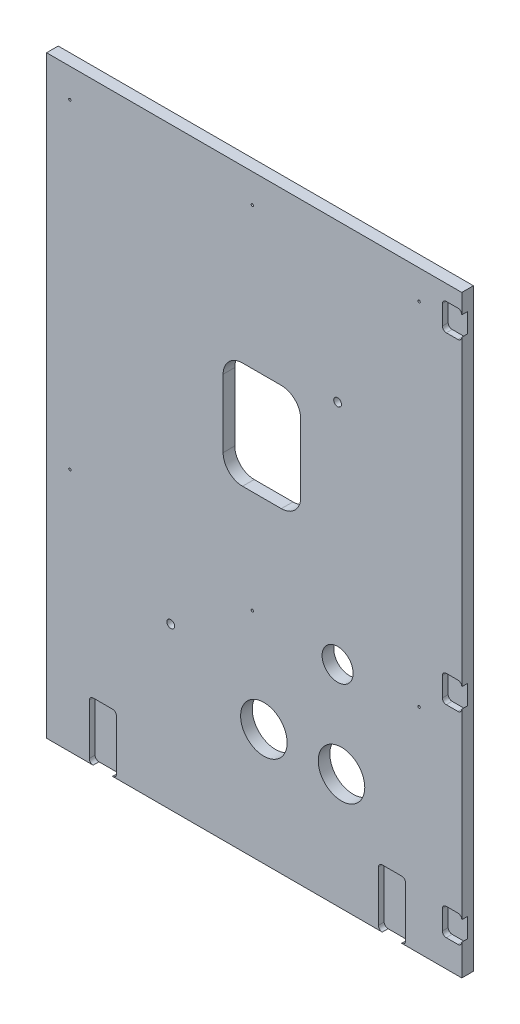
from build123d import *

# Parameters (mm, degrees)
SKETCH_1_W          = 1070
SKETCH_1_H          = 1530
EXTRUDE_1_DEPTH     = 15
SKETCH_2_R          = 40
SKETCH_2_R_2        = 60
SKETCH_2_R_3        = 10
CUT_EXTRUDE_1_DEPTH = 934.996788003
CUT_EXTRUDE_2_DEPTH = 15
SKETCH_5_R          = 3
CUT_EXTRUDE_3_DEPTH = 934.996788003


with BuildPart() as part:
    # Эскиз1 → Бобышка-Вытянуть1 (new, symmetric)
    with BuildSketch(Plane.XY):
        Rectangle(SKETCH_1_W, SKETCH_1_H)
    extrude(amount=EXTRUDE_1_DEPTH, both=True)

    # Эскиз2 → Вырез-Вытянуть1 (cut, through all)
    with BuildSketch(Plane.XY.offset(15)):
        with Locations((215, -225)):
            Circle(SKETCH_2_R)
        with Locations((225, -465)):
            Circle(SKETCH_2_R_2)
        with Locations((25, -465)):
            Circle(SKETCH_2_R_2)
        with Locations((215, 360)):
            Circle(SKETCH_2_R_3)
        with Locations((-215, -350)):
            Circle(SKETCH_2_R_3)
        with BuildLine():
            Line((-30, 325), (70, 325))
            ThreePointArc((70, 325), (105.355339059, 310.355339059), (120, 275))
            Line((120, 275), (120, 100))
            ThreePointArc((120, 100), (105.355339059, 64.644660941), (70, 50))
            Line((70, 50), (-30, 50))
            ThreePointArc((-30, 50), (-65.355339059, 64.644660941), (-80, 100))
            Line((-80, 100), (-80, 275))
            ThreePointArc((-80, 275), (-65.355339059, 310.355339059), (-30, 325))
        make_face()
    extrude(amount=-CUT_EXTRUDE_1_DEPTH, mode=Mode.SUBTRACT)

    # Эскиз4 → Вырез-Вытянуть2 (cut)
    with BuildSketch(Plane.XY.offset(15)):
        with BuildLine():
            Line((495, -105), (525, -105))
            ThreePointArc((525, -105), (532.071067812, -107.928932188), (535, -115))
            Line((535, -115), (535, -165))
            ThreePointArc((535, -165), (532.071067812, -172.071067812), (525, -175))
            Line((525, -175), (495, -175))
            ThreePointArc((495, -175), (487.928932188, -172.071067812), (485, -165))
            Line((485, -165), (485, -115))
            ThreePointArc((485, -115), (487.928932188, -107.928932188), (495, -105))
        make_face()
        with BuildLine():
            Line((495, -625), (525, -625))
            ThreePointArc((525, -625), (532.071067812, -627.928932188), (535, -635))
            Line((535, -635), (535, -685))
            ThreePointArc((535, -685), (532.071067812, -692.071067812), (525, -695))
            Line((525, -695), (495, -695))
            ThreePointArc((495, -695), (487.928932188, -692.071067812), (485, -685))
            Line((485, -685), (485, -635))
            ThreePointArc((485, -635), (487.928932188, -627.928932188), (495, -625))
        make_face()
        with BuildLine():
            Line((-415, -615), (-365, -615))
            ThreePointArc((-365, -615), (-357.928932188, -617.928932188), (-355, -625))
            Line((-355, -625), (-355, -755))
            ThreePointArc((-355, -755), (-357.928932188, -762.071067812), (-365, -765))
            Line((-365, -765), (-415, -765))
            ThreePointArc((-415, -765), (-422.071067812, -762.071067812), (-425, -755))
            Line((-425, -755), (-425, -625))
            ThreePointArc((-425, -625), (-422.071067812, -617.928932188), (-415, -615))
        make_face()
        with BuildLine():
            Line((495, 725), (525, 725))
            ThreePointArc((525, 725), (532.071067812, 722.071067812), (535, 715))
            Line((535, 715), (535, 665))
            ThreePointArc((535, 665), (532.071067812, 657.928932188), (525, 655))
            Line((525, 655), (495, 655))
            ThreePointArc((495, 655), (487.928932188, 657.928932188), (485, 665))
            Line((485, 665), (485, 715))
            ThreePointArc((485, 715), (487.928932188, 722.071067812), (495, 725))
        make_face()
        with BuildLine():
            Line((330, -615), (380, -615))
            ThreePointArc((380, -615), (387.071067812, -617.928932188), (390, -625))
            Line((390, -625), (390, -755))
            ThreePointArc((390, -755), (387.071067812, -762.071067812), (380, -765))
            Line((380, -765), (330, -765))
            ThreePointArc((330, -765), (322.928932188, -762.071067812), (320, -755))
            Line((320, -755), (320, -625))
            ThreePointArc((320, -625), (322.928932188, -617.928932188), (330, -615))
        make_face()
    extrude(amount=-CUT_EXTRUDE_2_DEPTH, mode=Mode.SUBTRACT)

    # Эскиз5 → Вырез-Вытянуть3 (cut, through all)
    with BuildSketch(Plane.XY.offset(15)):
        with Locations((-475, 690)):
            Circle(SKETCH_5_R)
        with Locations((-5, 690)):
            Circle(SKETCH_5_R)
        with Locations((425, 690)):
            Circle(SKETCH_5_R)
        with Locations((-475, -135)):
            Circle(SKETCH_5_R)
        with Locations((-5, -215)):
            Circle(SKETCH_5_R)
        with Locations((425, -215)):
            Circle(SKETCH_5_R)
    extrude(amount=-CUT_EXTRUDE_3_DEPTH, mode=Mode.SUBTRACT)


solid = part.part
